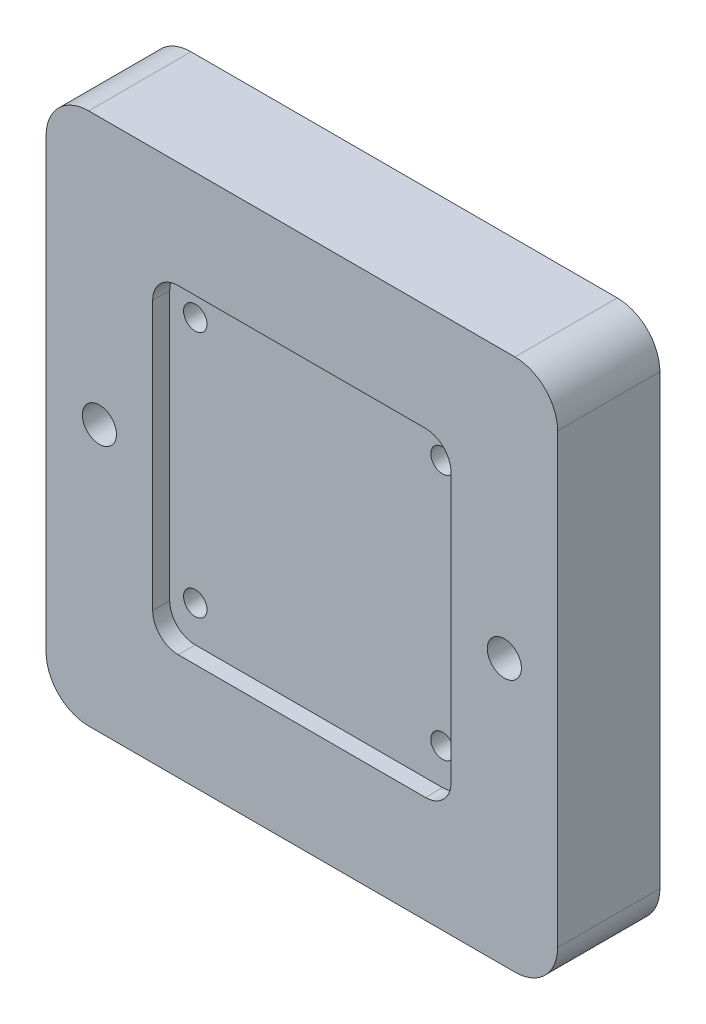
from build123d import *

# Parameters (mm, degrees)
BOSS_EXTRUDE1_DEPTH       = 4
BOSS_EXTRUDE2_DEPTH       = 20
F_8_0MM_DOWEL_HOLE1_D     = 8
F_8_0MM_DOWEL_HOLE1_DEPTH = 18
F_8_0MM_DOWEL_HOLE1_TIP   = 2.403442476
CUT_EXTRUDE1_DEPTH        = 89.917096219
CUT_EXTRUDE1_DEPTH_BACK   = 89.917096219
SKETCH8_R                 = 2.75
CUT_EXTRUDE2_START        = -7
CUT_EXTRUDE2_DEPTH        = 97.901334807


with BuildPart() as part:
    # Sketch1 → Boss-Extrude1 (new body)
    with BuildSketch(Plane.XY):
        with BuildLine():
            Line((-50, 62.5), (50, 62.5))
            ThreePointArc((50, 62.5), (57.071067812, 59.571067812), (60, 52.5))
            Line((60, 52.5), (60, -52.5))
            ThreePointArc((60, -52.5), (57.071067812, -59.571067812), (50, -62.5))
            Line((50, -62.5), (-50, -62.5))
            ThreePointArc((-50, -62.5), (-57.071067812, -59.571067812), (-60, -52.5))
            Line((-60, -52.5), (-60, 52.5))
            ThreePointArc((-60, 52.5), (-57.071067812, 59.571067812), (-50, 62.5))
        make_face()
        with BuildLine():
            Line((-29, 37.5), (29, 37.5))
            ThreePointArc((29, 37.5), (33.242640687, 35.742640687), (35, 31.5))
            Line((35, 31.5), (35, -31.5))
            ThreePointArc((35, -31.5), (33.242640687, -35.742640687), (29, -37.5))
            Line((29, -37.5), (-29, -37.5))
            ThreePointArc((-29, -37.5), (-33.242640687, -35.742640687), (-35, -31.5))
            Line((-35, -31.5), (-35, 31.5))
            ThreePointArc((-35, 31.5), (-33.242640687, 35.742640687), (-29, 37.5))
        make_face(mode=Mode.SUBTRACT)
    extrude(amount=-BOSS_EXTRUDE1_DEPTH)

    # Sketch2 → Boss-Extrude2 (add)
    with BuildSketch(Plane.XY.offset(-4)):
        with BuildLine():
            Line((-50, -62.5), (50, -62.5))
            ThreePointArc((50, -62.5), (57.071067812, -59.571067812), (60, -52.5))
            Line((60, -52.5), (60, 52.5))
            ThreePointArc((60, 52.5), (57.071067812, 59.571067812), (50, 62.5))
            Line((50, 62.5), (-50, 62.5))
            ThreePointArc((-50, 62.5), (-57.071067812, 59.571067812), (-60, 52.5))
            Line((-60, 52.5), (-60, -52.5))
            ThreePointArc((-60, -52.5), (-57.071067812, -59.571067812), (-50, -62.5))
        make_face()
    extrude(amount=-BOSS_EXTRUDE2_DEPTH)

    # Ø8.0mm Dowel Hole1
    with Locations(Plane.XY):
        with Locations((-47.5, 0), (47.5, 0)):
            Hole(F_8_0MM_DOWEL_HOLE1_D / 2, depth=F_8_0MM_DOWEL_HOLE1_DEPTH)
            with Locations((0, 0, -(F_8_0MM_DOWEL_HOLE1_DEPTH + F_8_0MM_DOWEL_HOLE1_TIP / 2))):  # 118° drill point
                Cone(0, F_8_0MM_DOWEL_HOLE1_D / 2, F_8_0MM_DOWEL_HOLE1_TIP, mode=Mode.SUBTRACT)

    # Sketch8 → Cut-Extrude1 (cut, two sides: drawn at the far end of the back side and taken through both)
    with BuildSketch(Plane.XY.offset(-4).offset(-CUT_EXTRUDE1_DEPTH_BACK)):
        with Locations((-29, 29)):
            Circle(SKETCH8_R)
        with Locations((29, 29)):
            Circle(SKETCH8_R)
        with Locations((29, -29)):
            Circle(SKETCH8_R)
        with Locations((-29, -29)):
            Circle(SKETCH8_R)
    extrude(amount=CUT_EXTRUDE1_DEPTH + CUT_EXTRUDE1_DEPTH_BACK, mode=Mode.SUBTRACT)

    # Sketch9 → Cut-Extrude2 (cut)
    with BuildSketch(Plane(origin=(0, 0, -24), x_dir=(-1, 0, 0), z_dir=(0, 0, -1)).offset(CUT_EXTRUDE2_START)):
        Polygon((-33.1, 26.632863896), (-29, 24.265727793), (-24.9, 26.632863896), (-24.9, 31.367136104), (-29, 33.734272207), (-33.1, 31.367136104), align=None)
    cut_extrude2 = extrude(amount=CUT_EXTRUDE2_DEPTH, mode=Mode.SUBTRACT)

    # Sketch-Pattern1: Cut-Extrude2 at 3 more places
    with Locations((-58, 0, 0), (0, -58, 0), (-58, -58, 0)):
        add(cut_extrude2, mode=Mode.SUBTRACT)


solid = part.part
